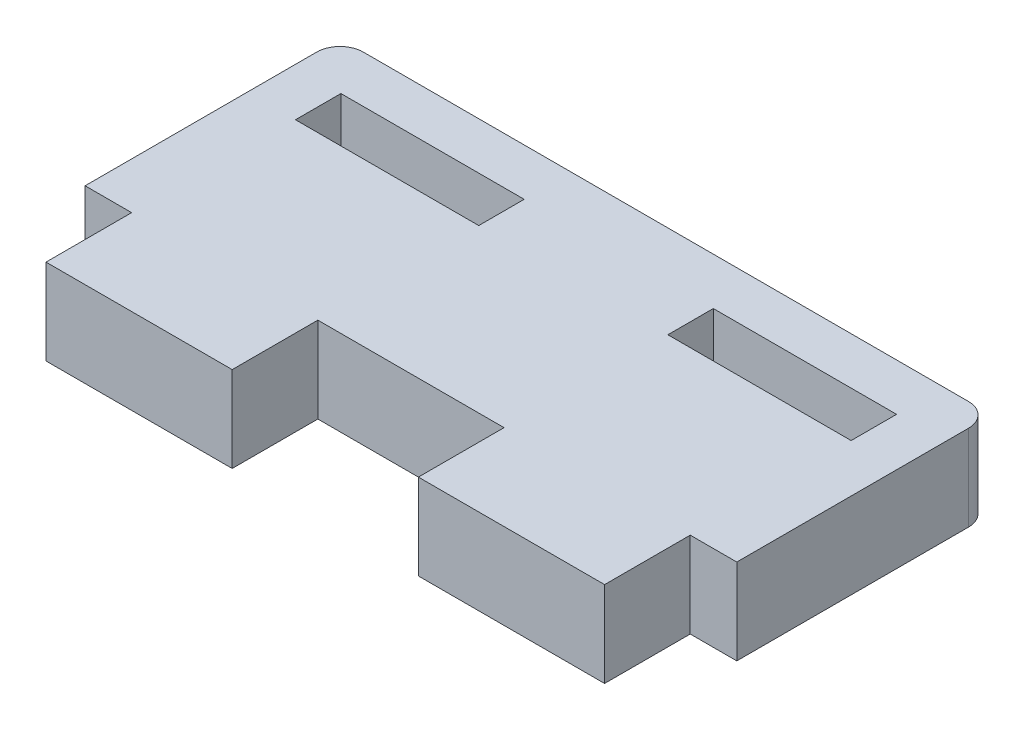
from build123d import *

# Parameters (mm, degrees)
SKETCH1_W           = 12.5
SKETCH1_H           = 3.0988
BOSS_EXTRUDE1_DEPTH = 5.842
FILLET1_R           = 1.5875


with BuildPart() as part:
    # Sketch1 → Boss-Extrude1 (new body)
    with BuildSketch(Plane(origin=(0, 0, 0), x_dir=(1, 0, 0), z_dir=(0, 1, 0))):
        Polygon((22.225, -6.35), (19.05, -6.35), (19.05, -12.192), (6.35, -12.192), (6.35, -6.35), (-6.35, -6.35), (-6.35, -12.192), (-19.05, -12.192), (-19.05, -6.35), (-22.225, -6.35), (-22.225, 6.35), (-22.225, 9.4488), (-22.225, 11.0363), (22.225, 11.0363), (22.225, 9.4488), (22.225, 6.35), align=None)
        with Locations((12.7, 6.2738)):
            Rectangle(SKETCH1_W, SKETCH1_H, mode=Mode.SUBTRACT)
        with Locations((-12.7, 6.2738)):
            Rectangle(SKETCH1_W, SKETCH1_H, mode=Mode.SUBTRACT)
    extrude(amount=BOSS_EXTRUDE1_DEPTH)

    # Fillet1
    fillet1_edges = [part.edges().sort_by_distance(p)[0] for p in [
        (22.225, 2.921, -11.0363),
        (-22.225, 2.921, -11.0363),
    ]]
    fillet(fillet1_edges, radius=FILLET1_R)


solid = part.part
